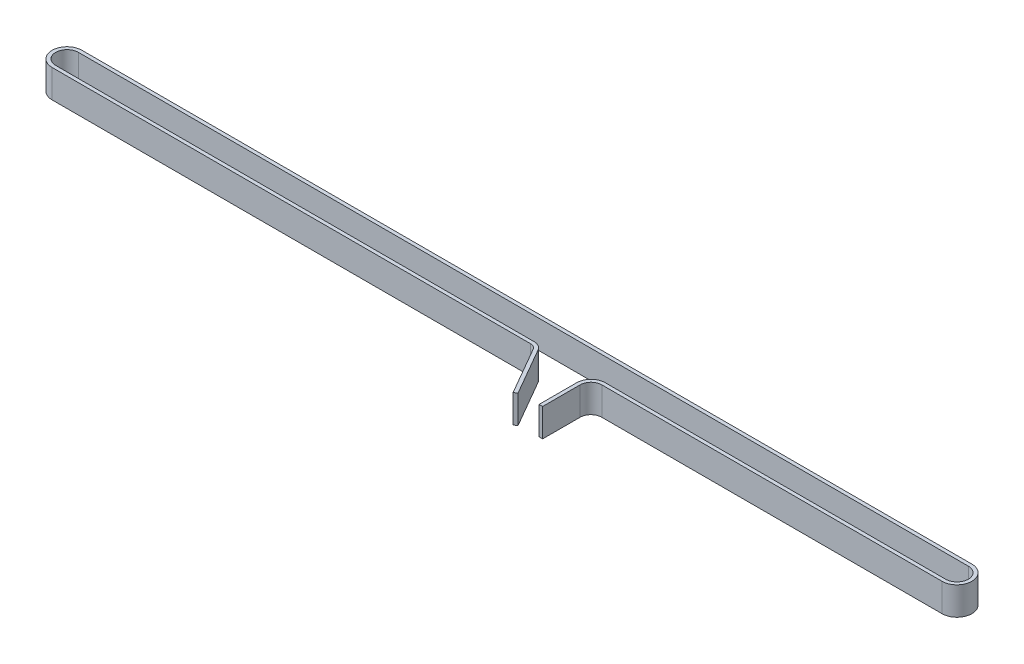
from build123d import *

# Parameters (mm, degrees)
EXTRUDE_THIN1_DEPTH = 12


with BuildPart() as part:
    # Sketch1 → Extrude-Thin1 (new body)
    with BuildSketch(Plane(origin=(0, 0, 0), x_dir=(1, 0, 0), z_dir=(0, 1, 0))):
        with BuildLine():
            Line((218.603076211, -28.129994449), (206.903076211, -7.865))
            ThreePointArc((206.903076211, -7.865), (205.805, -6.766923789), (204.305, -6.365))
            Line((204.305, -6.365), (0, -6.365))
            ThreePointArc((0, -6.365), (-6.365, 0), (0, 6.365))
            Line((0, 6.365), (380, 6.365))
            ThreePointArc((380, 6.365), (386.365, 0), (380, -6.365))
            Line((380, -6.365), (234.695, -6.365))
            ThreePointArc((234.695, -6.365), (231.428873778, -7.717873778), (230.076, -10.984))
            Line((230.076, -10.984), (230.076, -26.984))
            Line((230.076, -26.984), (228.556, -26.984))
            Line((228.556, -26.984), (228.556, -10.984))
            ThreePointArc((228.556, -10.984), (230.35407147, -6.64307147), (234.695, -4.845))
            Line((234.695, -4.845), (380, -4.845))
            ThreePointArc((380, -4.845), (384.845, 0), (380, 4.845))
            Line((380, 4.845), (0, 4.845))
            ThreePointArc((0, 4.845), (-4.845, 0), (0, -4.845))
            Line((0, -4.845), (204.305, -4.845))
            ThreePointArc((204.305, -4.845), (206.565, -5.450565175), (208.219434825, -7.105))
            Line((208.219434825, -7.105), (219.919434825, -27.369994449))
            Line((219.919434825, -27.369994449), (218.603076211, -28.129994449))
        make_face()
    extrude(amount=EXTRUDE_THIN1_DEPTH)


solid = part.part
